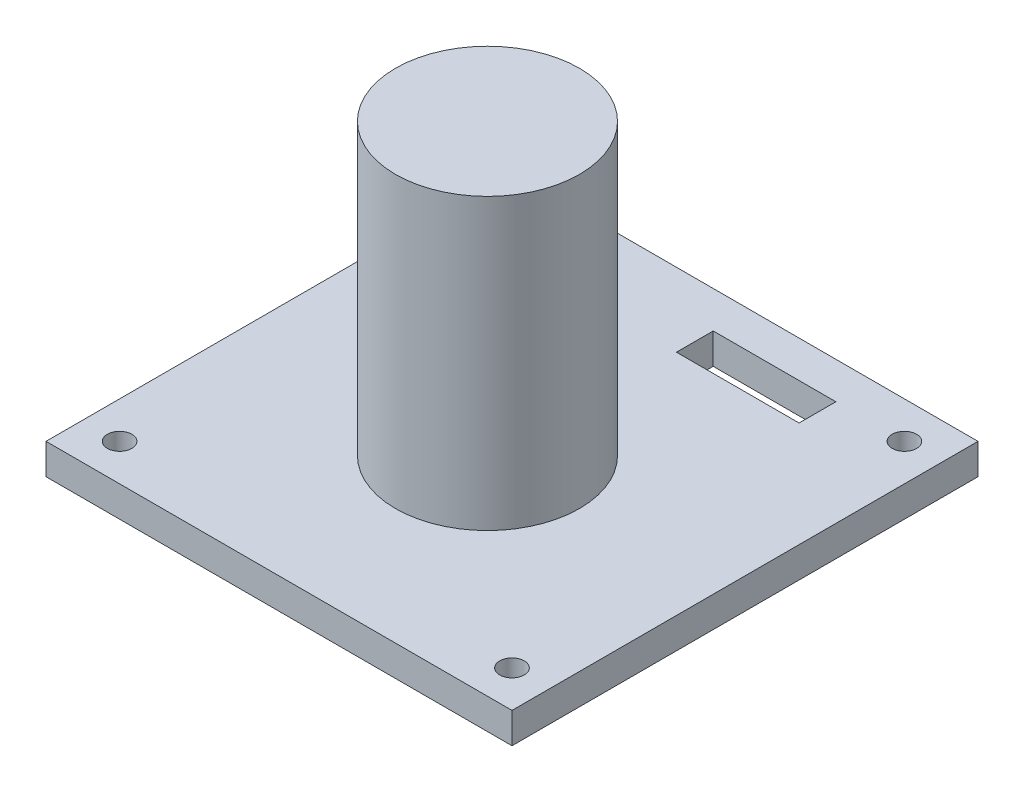
from build123d import *

# Parameters (mm, degrees)
SKETCH1_W           = 38
SKETCH1_H           = 38
SKETCH1_R           = 1
SKETCH1_R_2         = 7.5
SKETCH1_W_2         = 10
SKETCH1_H_2         = 3
BOSS_EXTRUDE1_DEPTH = 2.5
SKETCH1_6_R         = 7.5
BOSS_EXTRUDE2_DEPTH = 26.1


with BuildPart() as part:
    # Sketch1 → Boss-Extrude1 (new body)
    with BuildSketch(Plane(origin=(0, 0, 0), x_dir=(1, 0, 0), z_dir=(0, 1, 0))):
        with Locations((0, 2)):
            Rectangle(SKETCH1_W, SKETCH1_H)
        with Locations((-16, -14)):
            Circle(SKETCH1_R, mode=Mode.SUBTRACT)
        with Locations((16, -14)):
            Circle(SKETCH1_R, mode=Mode.SUBTRACT)
        Circle(SKETCH1_R_2, mode=Mode.SUBTRACT)
        with Locations((-16, 18)):
            Circle(SKETCH1_R, mode=Mode.SUBTRACT)
        with Locations((5.41, 16.5)):
            Rectangle(SKETCH1_W_2, SKETCH1_H_2, mode=Mode.SUBTRACT)
        with Locations((16, 18)):
            Circle(SKETCH1_R, mode=Mode.SUBTRACT)
    extrude(amount=BOSS_EXTRUDE1_DEPTH)

    # Sketch1<6> → Boss-Extrude2 (add)
    with BuildSketch(Plane(origin=(0, 0, 0), x_dir=(1, 0, 0), z_dir=(0, 1, 0))):
        Circle(SKETCH1_6_R)
    extrude(amount=BOSS_EXTRUDE2_DEPTH)


solid = part.part
